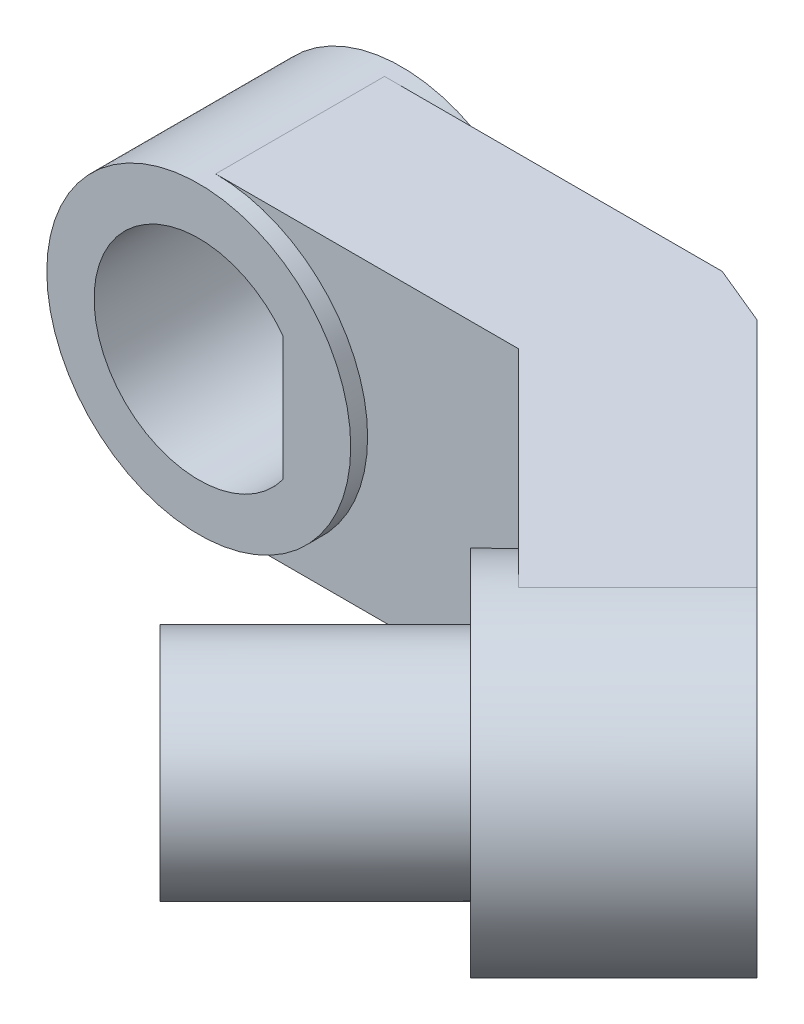
from build123d import *
from build123d.topology import SkipClean

# Parameters (mm, degrees)
SKETCH_1_R      = 4.5
EXTRUDE_1_DEPTH = 3
EXTRUDE_2_DEPTH = 2.5
EXTRUDE_3_DEPTH = 2.5
LOFT_START      = -4.5
LOFT_1_DEPTH    = 9
SKETCH_4_R      = 2.9
EXTRUDE_5_DEPTH = 10
SKETCH_5_R      = 4.5
EXTRUDE_6_DEPTH = 1


# Read off the part's stored shape, not the designer's step: 放样1
with BuildPart() as part:
    # 草图1 → 凸台-拉伸1 (new, symmetric)
    with BuildSketch(Plane.XY):
        Circle(SKETCH_1_R)
        with BuildLine():
            Line((2.5, -1.833030278), (2.5, 1.833030278))
            ThreePointArc((2.5, 1.833030278), (-3.1, 0), (2.5, -1.833030278))
        make_face(mode=Mode.SUBTRACT)
    extrude(amount=EXTRUDE_1_DEPTH, both=True)

    # 草图2 → 凸台-拉伸2 (add, symmetric)
    with BuildSketch(Plane.XY):
        with BuildLine():
            ThreePointArc((4.5, 0), (3.181980515, -3.181980515), (0, -4.5))
            Line((0, -4.5), (10, -4.5))
            Line((10, -4.5), (10, 4.5))
            Line((10, 4.5), (0, 4.5))
            ThreePointArc((0, 4.5), (3.181980515, 3.181980515), (4.5, 0))
        make_face()
    extrude(amount=EXTRUDE_2_DEPTH, both=True)

    # 草图3 → 凸台-拉伸3 (add, symmetric)
    with BuildSketch(Plane(origin=(5, 0, -5), x_dir=(0, 1, 0), z_dir=(0.7071067811865438, 0, -0.7071067811865512))):
        with BuildLine():
            Line((-4.5, 7.071067812), (4.5, 7.071067812))
            Line((4.5, 7.071067812), (4.5, 16.771067812))
            ThreePointArc((4.5, 16.771067812), (0, 21.271067812), (-4.5, 16.771067812))
            Line((-4.5, 16.771067812), (-4.5, 7.071067812))
        make_face()
    extrude(amount=EXTRUDE_3_DEPTH, both=True)

    # 放样1 outline → 放样1 (add)
    with BuildSketch(Plane(origin=(0, 0, 0), x_dir=(1, 0, 0), z_dir=(0, 1, 0)).offset(LOFT_START)):
        Polygon((10, 0), (11.767766953, 1.767766953), (10, 2.5), align=None)
    extrude(amount=LOFT_1_DEPTH)

    # 草图4 → 凸台-拉伸5 (add)
    with BuildSketch(Plane(origin=(5, 0, -5), x_dir=(0, 1, 0), z_dir=(0.7071067811865438, 0, -0.7071067811865512))):
        with Locations(Location((0, 16.771067812, 0), (0, 0, 270))):
            Circle(SKETCH_4_R)
    extrude(amount=-EXTRUDE_5_DEPTH)

    # 草图5 → 凸台-拉伸6 (add)
    with SkipClean():  # the faces are left unmerged after this step: merging them gives an invalid solid
        with BuildSketch(Plane(origin=(3.232233047, 0, -3.232233047), x_dir=(0.7071067811865512, 0, 0.7071067811865438), z_dir=(-0.7071067811865438, 0, 0.7071067811865512))):
            with Locations((16.771067812, 0)):
                Circle(SKETCH_5_R)
        extrude(amount=EXTRUDE_6_DEPTH)
    add(part.part.scale(1), mode=Mode.REPLACE)  # the faces are merged on a copy


solid = part.part
